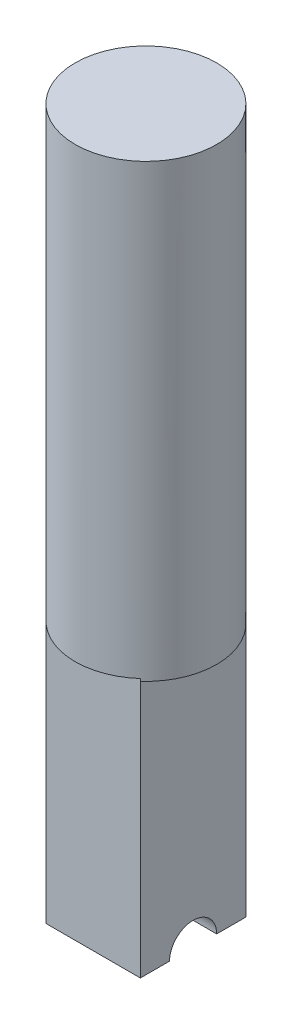
from build123d import *

# Parameters (mm, degrees)
SKETCH2_R           = 15
BOSS_EXTRUDE1_DEPTH = 150
CUT_EXTRUDE1_START  = 10
SKETCH3_W           = 30
SKETCH3_H           = 108.98871412
CUT_EXTRUDE1_DEPTH  = 100
CUT_EXTRUDE2_START  = -10
SKETCH3_2_W         = 30
SKETCH3_2_H         = 108.98871412
CUT_EXTRUDE2_DEPTH  = 100
CUT_EXTRUDE4_DEPTH  = 55
SKETCH4_R           = 5
CUT_EXTRUDE5_DEPTH  = 153.807067899


with BuildPart() as part:
    # Sketch2 → Boss-Extrude1 (new body)
    with BuildSketch(Plane(origin=(0, 0, 0), x_dir=(1, 0, 0), z_dir=(0, 1, 0))):
        Circle(SKETCH2_R)
    extrude(amount=BOSS_EXTRUDE1_DEPTH)

    # Sketch3 → Cut-Extrude1 (cut)
    with BuildSketch(Plane(origin=(0, 0, 0), x_dir=(0, 0, -1), z_dir=(1, 0, 0)).offset(CUT_EXTRUDE1_START)):
        Rectangle(SKETCH3_W, SKETCH3_H)
    extrude(amount=CUT_EXTRUDE1_DEPTH, mode=Mode.SUBTRACT)

    # Sketch3<2> → Cut-Extrude2 (cut)
    with BuildSketch(Plane(origin=(0, 0, 0), x_dir=(0, 0, -1), z_dir=(1, 0, 0)).offset(CUT_EXTRUDE2_START)):
        Rectangle(SKETCH3_2_W, SKETCH3_2_H)
    extrude(amount=-CUT_EXTRUDE2_DEPTH, mode=Mode.SUBTRACT)

    # Sketch5 → Cut-Extrude4 (cut)
    with BuildSketch(Plane.XZ):
        with BuildLine():
            Line((-10, 11.180339887), (10, 11.180339887))
            ThreePointArc((10, 11.180339887), (0, 15), (-10, 11.180339887))
        make_face()
        with BuildLine():
            Line((-10, -11.180339887), (10, -11.180339887))
            ThreePointArc((10, -11.180339887), (0, -15), (-10, -11.180339887))
        make_face()
    extrude(amount=-CUT_EXTRUDE4_DEPTH, mode=Mode.SUBTRACT)

    # Sketch4 → Cut-Extrude5 (cut, through all)
    with BuildSketch(Plane(origin=(10, 0, 0), x_dir=(0, 0, -1), z_dir=(1, 0, 0))):
        with Locations((0.000339887, 0)):
            Circle(SKETCH4_R)
    extrude(amount=-CUT_EXTRUDE5_DEPTH, mode=Mode.SUBTRACT)


solid = part.part
